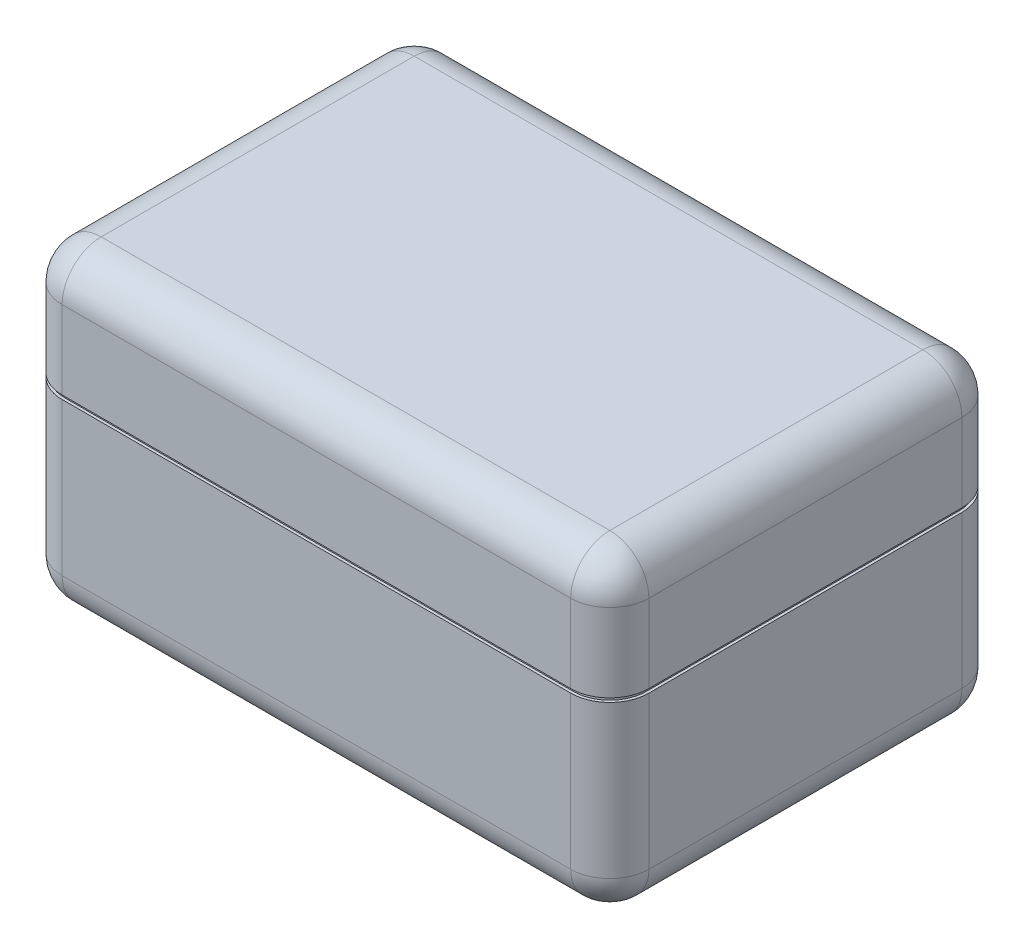
from build123d import *

# Parameters (mm, degrees)
BOSS_EXTRUDE1_DEPTH    = 100
FILLET1_R              = 20
SHELL1_T               = -3
BOSS_EXTRUDE2_DEPTH    = 60
FILLET2_R              = 20
SHELL3_T               = -3
SELECT_FEATURES1_DEPTH = 2
SELECT_FEATURES1_TAPER = -3


with BuildPart() as part:
    # Sketch1 → Boss-Extrude1 (new body)
    with BuildSketch(Plane(origin=(0, 0, 0), x_dir=(1, 0, 0), z_dir=(0, 1, 0))):
        with BuildLine():
            Line((-130, 100), (130, 100))
            ThreePointArc((130, 100), (144.142135624, 94.142135624), (150, 80))
            Line((150, 80), (150, -80))
            ThreePointArc((150, -80), (144.142135624, -94.142135624), (130, -100))
            Line((130, -100), (-130, -100))
            ThreePointArc((-130, -100), (-144.142135624, -94.142135624), (-150, -80))
            Line((-150, -80), (-150, 80))
            ThreePointArc((-150, 80), (-144.142135624, 94.142135624), (-130, 100))
        make_face()
    extrude(amount=BOSS_EXTRUDE1_DEPTH)

    # Fillet1
    fillet1_edges = [part.edges().sort_by_distance(p)[0] for p in [
        (-150, 0, 0),
        (-144.142135624, 0, -94.142135624),
        (0, 0, -100),
        (144.142135624, 0, -94.142135624),
        (150, 0, 0),
        (144.142135624, 0, 94.142135624),
        (0, 0, 100),
        (-144.142135624, 0, 94.142135624),
    ]]
    fillet(fillet1_edges, radius=FILLET1_R)

    # Shell1
    shell1_openings = [part.faces().sort_by_distance(p)[0] for p in [
        (0, 100, 0),
    ]]
    offset(amount=SHELL1_T, openings=shell1_openings, kind=Kind.INTERSECTION)

    # Select Features1: read off the stored shape, not the designer's step
    # Select Features1 outline → Select Features1 (cut)
    with BuildSketch(Plane(origin=(0, 98, 0), x_dir=(1, 0, 0), z_dir=(0, 1, 0))):
        with BuildLine():
            Line((130, 100), (-130, 100))
            ThreePointArc((-130, 100), (-144.142135624, 94.142135624), (-150, 80))
            Line((-150, 80), (-150, -80))
            ThreePointArc((-150, -80), (-144.142135624, -94.142135624), (-130, -100))
            Line((-130, -100), (130, -100))
            ThreePointArc((130, -100), (144.142135624, -94.142135624), (150, -80))
            Line((150, -80), (150, 80))
            ThreePointArc((150, 80), (144.142135624, 94.142135624), (130, 100))
        make_face()
        with BuildLine():
            Line((-130, 98.604815559), (130, 98.604815559))
            ThreePointArc((130, 98.604815559), (143.155591244, 93.155591244), (148.604815559, 80))
            Line((148.604815559, 80), (148.604815559, -80))
            ThreePointArc((148.604815559, -80), (143.155591244, -93.155591244), (130, -98.604815559))
            Line((130, -98.604815559), (-130, -98.604815559))
            ThreePointArc((-130, -98.604815559), (-143.155591244, -93.155591244), (-148.604815559, -80))
            Line((-148.604815559, -80), (-148.604815559, 80))
            ThreePointArc((-148.604815559, 80), (-143.155591244, 93.155591244), (-130, 98.604815559))
        make_face(mode=Mode.SUBTRACT)
    extrude(amount=SELECT_FEATURES1_DEPTH, taper=SELECT_FEATURES1_TAPER, mode=Mode.SUBTRACT)


with BuildPart() as body_2:
    # Sketch2 → Boss-Extrude2 (new body)
    with BuildSketch(Plane(origin=(0, 100, 0), x_dir=(1, 0, 0), z_dir=(0, 1, 0))):
        with BuildLine():
            Line((130, 100), (-130, 100))
            ThreePointArc((-130, 100), (-144.142135624, 94.142135624), (-150, 80))
            Line((-150, 80), (-150, -80))
            ThreePointArc((-150, -80), (-144.142135624, -94.142135624), (-130, -100))
            Line((-130, -100), (130, -100))
            ThreePointArc((130, -100), (144.142135624, -94.142135624), (150, -80))
            Line((150, -80), (150, 80))
            ThreePointArc((150, 80), (144.142135624, 94.142135624), (130, 100))
        make_face()
    extrude(amount=BOSS_EXTRUDE2_DEPTH)

    # Fillet2
    fillet2_edges = [body_2.edges().sort_by_distance(p)[0] for p in [
        (-144.142135624, 160, 94.142135624),
        (0, 160, 100),
        (144.142135624, 160, 94.142135624),
        (150, 160, 0),
        (144.142135624, 160, -94.142135624),
        (0, 160, -100),
        (-144.142135624, 160, -94.142135624),
        (-150, 160, 0),
    ]]
    fillet(fillet2_edges, radius=FILLET2_R)

    # Shell3
    shell3_openings = [body_2.faces().sort_by_distance(p)[0] for p in [
        (0, 100, 0),
    ]]
    offset(amount=SHELL3_T, openings=shell3_openings, kind=Kind.INTERSECTION)

    # Groove2: read off the stored shape, not the designer's step
    # Groove2: loft between two sections, ruled curve by curve
    groove2_from = [
        Edge.make_three_point_arc((-148.395184441, 102, -80), (-143.00735966, 102, -93.00735966), (-130, 102, -98.395184441)),
        Edge.make_three_point_arc((130, 102, -98.395184441), (143.00735966, 102, -93.00735966), (148.395184441, 102, -80)),
        Edge.make_three_point_arc((148.395184441, 102, 80), (143.00735966, 102, 93.00735966), (130, 102, 98.395184441)),
        Edge.make_three_point_arc((-130, 102, 98.395184441), (-143.00735966, 102, 93.00735966), (-148.395184441, 102, 80)),
        Edge.make_line((-148.395184441, 102, -80), (-148.395184441, 102, 80)),
        Edge.make_line((130, 102, -98.395184441), (-130, 102, -98.395184441)),
        Edge.make_line((148.395184441, 102, 80), (148.395184441, 102, -80)),
        Edge.make_line((-130, 102, 98.395184441), (130, 102, 98.395184441)),
    ]
    groove2_to = [
        Edge.make_three_point_arc((-148.5, 100, -80), (-143.081475452, 100, -93.081475452), (-130, 100, -98.5)),
        Edge.make_three_point_arc((130, 100, -98.5), (143.081475452, 100, -93.081475452), (148.5, 100, -80)),
        Edge.make_three_point_arc((148.5, 100, 80), (143.081475452, 100, 93.081475452), (130, 100, 98.5)),
        Edge.make_three_point_arc((-130, 100, 98.5), (-143.081475452, 100, 93.081475452), (-148.5, 100, 80)),
        Edge.make_line((-148.5, 100, -80), (-148.5, 100, 80)),
        Edge.make_line((130, 100, -98.5), (-130, 100, -98.5)),
        Edge.make_line((148.5, 100, 80), (148.5, 100, -80)),
        Edge.make_line((-130, 100, 98.5), (130, 100, 98.5)),
    ]
    groove2 = Solid(Shell([*[Face.make_surface_from_curves(groove2_from[k], groove2_to[k]) for k in range(8)], Face(Wire(groove2_from)), Face(Wire(groove2_to))]))
    add(groove2, mode=Mode.SUBTRACT)


solid = Compound([part.part, body_2.part])
